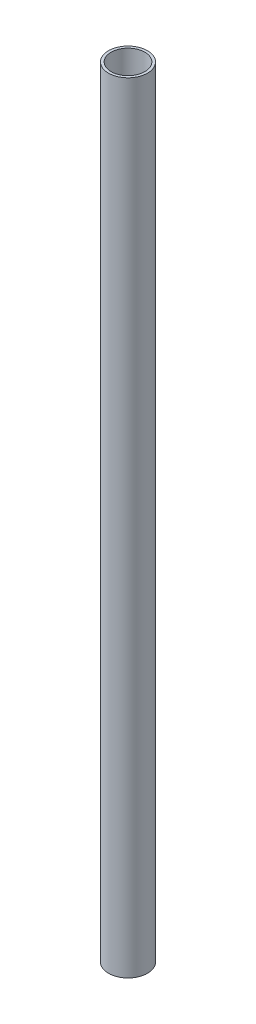
from build123d import *

# Parameters (mm, degrees)
SKETCH1_R           = 15
SKETCH1_R_2         = 13
BOSS_EXTRUDE1_DEPTH = 600


with BuildPart() as part:
    # Sketch1 → Boss-Extrude1 (new body)
    with BuildSketch(Plane(origin=(0, 0, 0), x_dir=(1, 0, 0), z_dir=(0, 1, 0))):
        Circle(SKETCH1_R)
        Circle(SKETCH1_R_2, mode=Mode.SUBTRACT)
    extrude(amount=BOSS_EXTRUDE1_DEPTH)


solid = part.part
